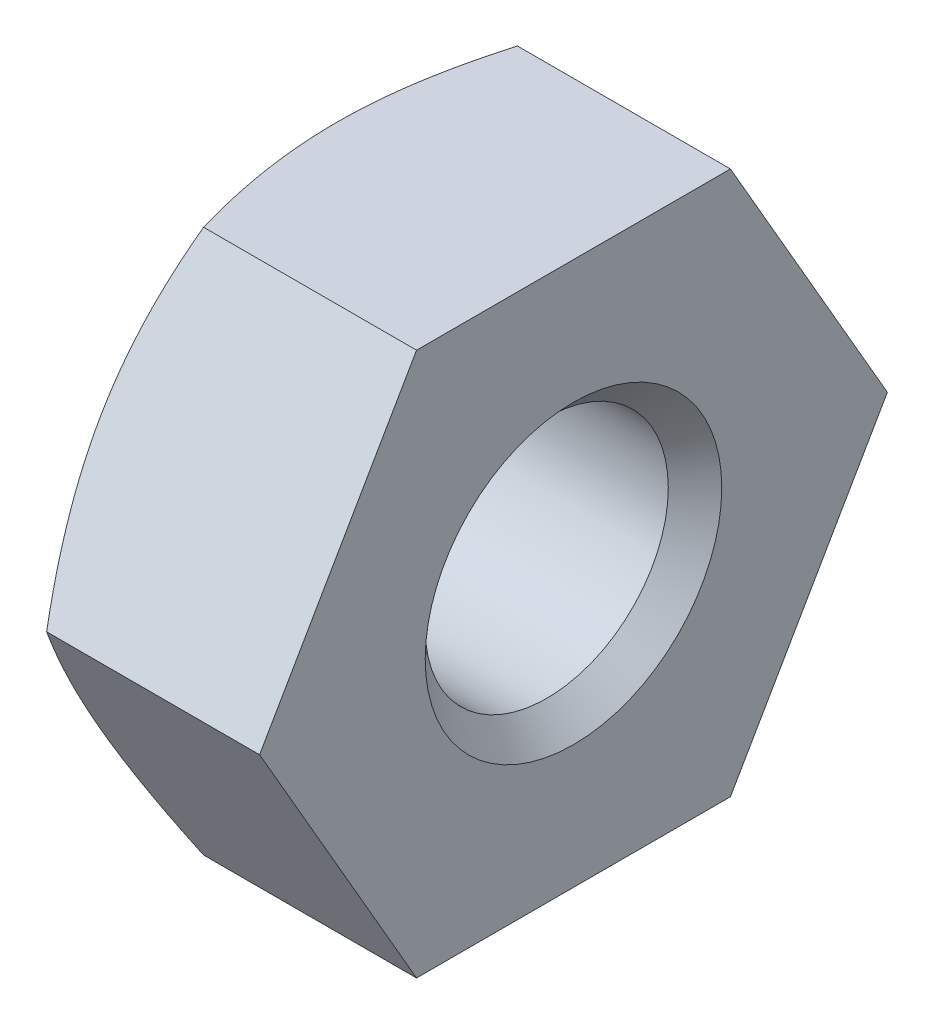
from build123d import *

# Parameters (mm, degrees)
CUT_EXTRUDE_1_DEPTH      = 1.2
CUT_EXTRUDE_1_DEPTH_BACK = 1.2
SKETCH_3_W               = 11
SKETCH_3_H               = 11


with BuildPart() as part:
    # 草图1 → 旋转1 (revolve)
    with BuildSketch(Plane.XY):
        Polygon((-1.2, 0), (-1.2, 2.75), (-0.940192379, 3.2), (1.2, 3.2), (1.2, 0), align=None)
    revolve(axis=Axis((1.2, 0, 0), (-1, 0, 0)))

    # 草图2 → 切除-旋转1 (revolve, cut)
    with BuildSketch(Plane.XY):
        Polygon((-1.2, 0), (-1.2, 1.5), (-0.9295, 1.2295), (0.9295, 1.2295), (1.2, 1.5), (1.2, 0), align=None)
    revolve(axis=Axis((1.2, 0, 0), (-1, 0, 0)), mode=Mode.SUBTRACT)

    # 草图3 → 切除-拉伸1 (cut, two sides: drawn at the far end of the back side and taken through both)
    with BuildSketch(Plane(origin=(0, 0, 0), x_dir=(0, 0, -1), z_dir=(1, 0, 0)).offset(-CUT_EXTRUDE_1_DEPTH_BACK)):
        Rectangle(SKETCH_3_W, SKETCH_3_H)
        Polygon((-3.175426481, 0), (-1.58771324, -2.75), (1.58771324, -2.75), (3.175426481, 0), (1.58771324, 2.75), (-1.58771324, 2.75), align=None, mode=Mode.SUBTRACT)
    extrude(amount=CUT_EXTRUDE_1_DEPTH + CUT_EXTRUDE_1_DEPTH_BACK, mode=Mode.SUBTRACT)


solid = part.part
